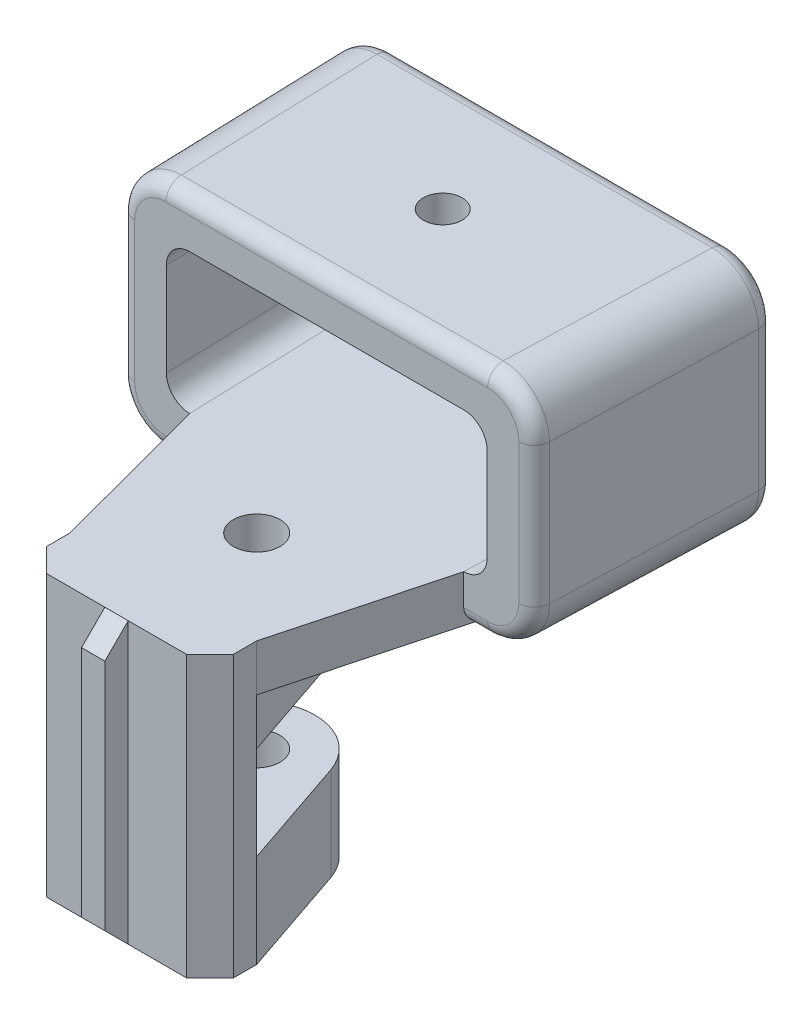
from build123d import *

# Parameters (mm, degrees)
SKETCH_1_R          = 3
EXTRUDE_1_DEPTH     = 12
SKETCH_2_W          = 24
SKETCH_2_H          = 6
EXTRUDE_2_DEPTH     = 36
EXTRUDE_START       = -12
SKETCH_3_R          = 3
EXTRUDE_3_DEPTH     = 12
EXTRUDE_START_2     = -6
SKETCH_5_R          = 3
EXTRUDE_5_DEPTH     = 6
EXTRUDE_7_DEPTH     = 30
EXTRUDE_8_DEPTH     = 3
SKETCH_10_R         = 2.5
EXTRUDE_9_DEPTH     = 6
FILLET_1_R          = 3
FILLET_2_R          = 6
SKETCH_11_W         = 3
SKETCH_11_H         = 12
EXTRUDE_10_DEPTH    = 1.5
SKETCH_12_W         = 73.854631002
SKETCH_12_H         = 4.710162055
CUT_EXTRUDE_1_DEPTH = 13
CUT_EXTRUDE_2_DEPTH = 13
FILLET_3_R          = 2
CHAMFER_1_SIZE      = 3


with BuildPart() as part:
    # 스케치1 → 보스-돌출1 (new body)
    with BuildSketch(Plane(origin=(0, 0, 0), x_dir=(1, 0, 0), z_dir=(0, 1, 0))):
        with BuildLine():
            Line((-12, -12), (12, -12))
            Line((12, -12), (7.101042921, 2.413542921))
            ThreePointArc((7.101042921, 2.413542921), (0, 7.5), (-7.101042921, 2.413542921))
            Line((-7.101042921, 2.413542921), (-12, -12))
        make_face()
        Circle(SKETCH_1_R, mode=Mode.SUBTRACT)
    extrude(amount=EXTRUDE_1_DEPTH)

    # 스케치2 → 보스-돌출2 (add)
    with BuildSketch(Plane(origin=(0, 0, 0), x_dir=(1, 0, 0), z_dir=(0, 1, 0))):
        with Locations((0, -15)):
            Rectangle(SKETCH_2_W, SKETCH_2_H)
    extrude(amount=EXTRUDE_2_DEPTH)

    # 스케치3 → 보스-돌출3 (add)
    with BuildSketch(Plane(origin=(0, 36, 0), x_dir=(1, 0, 0), z_dir=(0, 1, 0)).offset(EXTRUDE_START)):
        with BuildLine():
            Line((-7.101042921, 2.413542921), (-12, -12))
            Line((-12, -12), (12, -12))
            Line((12, -12), (7.101042921, 2.413542921))
            ThreePointArc((7.101042921, 2.413542921), (0, 7.5), (-7.101042921, 2.413542921))
        make_face()
        Circle(SKETCH_3_R, mode=Mode.SUBTRACT)
    extrude(amount=EXTRUDE_3_DEPTH)

    # 스케치5 → 보스-돌출5 (add)
    with BuildSketch(Plane(origin=(0, 36, 0), x_dir=(1, 0, 0), z_dir=(0, 1, 0)).offset(EXTRUDE_START_2)):
        Polygon((20.6, 9), (21.6, 39), (-21.6, 39), (-20.6, 9), (-12, -12), (12, -12), align=None)
        Circle(SKETCH_5_R, mode=Mode.SUBTRACT)
    extrude(amount=EXTRUDE_5_DEPTH)

    # 스케치8 → 보스-돌출7 (add)
    with BuildSketch(Plane.XZ.offset(-30)):
        Polygon((-27.603332408, -39), (-21.6, -39), (-20.6, -9), (-26.603332408, -9), align=None)
        Polygon((20.6, -9), (26.603332408, -9), (27.603332408, -39), (21.6, -39), align=None)
    extrude(amount=-EXTRUDE_7_DEPTH)

    # 스케치9 → 보스-돌출8 (add, symmetric)
    with BuildSketch(Plane(origin=(0, 0, 0), x_dir=(0, 0, -1), z_dir=(1, 0, 0))):
        Polygon((33.7, 30), (6.7, 25), (6.7, 30), align=None)
    extrude(amount=EXTRUDE_8_DEPTH, both=True)

    # 스케치10 → 보스-돌출9 (add)
    with BuildSketch(Plane(origin=(0, 60, 0), x_dir=(1, 0, 0), z_dir=(0, 1, 0))):
        Polygon((20.6, 9), (21.6, 39), (-21.7, 39), (-20.6, 9), align=None)
        with Locations((-0.101268067, 24)):
            Circle(SKETCH_10_R, mode=Mode.SUBTRACT)
    extrude(amount=-EXTRUDE_9_DEPTH)

    # 필렛1
    fillet_1_edges = [part.edges().sort_by_distance(p)[0] for p in [
        (-21.1, 54, -24),
        (-21.1, 36, -24),
        (21.1, 36, -24),
        (21.1, 54, -24),
    ]]
    fillet(fillet_1_edges, radius=FILLET_1_R)

    # 필렛2
    fillet_2_edges = [part.edges().sort_by_distance(p)[0] for p in [
        (-27.103332408, 60, -24),
        (-27.103332408, 30, -24),
        (27.103332408, 30, -24),
        (27.103332408, 60, -24),
    ]]
    fillet(fillet_2_edges, radius=FILLET_2_R)

    # 스케치11 → 보스-돌출10 (add, symmetric)
    with BuildSketch(Plane(origin=(0, 0, 0), x_dir=(0, 0, -1), z_dir=(1, 0, 0))):
        with Locations((-10.5, 18)):
            Rectangle(SKETCH_11_W, SKETCH_11_H)
        Polygon((-18, 36), (-18, 0), (-21, 3), (-21, 33), align=None)
    extrude(amount=EXTRUDE_10_DEPTH, both=True)

    # 스케치12 → 컷-돌출1 (cut)
    with BuildSketch(Plane.XY.offset(-9)):
        with Locations((-1.11650338, 38.355081028)):
            Rectangle(SKETCH_12_W, SKETCH_12_H)
    extrude(amount=CUT_EXTRUDE_1_DEPTH, mode=Mode.SUBTRACT)

    # 스케치13 → 컷-돌출2 (cut)
    with BuildSketch(Plane(origin=(0, 36, 0), x_dir=(1, 0, 0), z_dir=(0, 1, 0))):
        Polygon((-17.598333796, 9), (-12, -12), (-14.220944906, -12), (-22.942076864, 9), align=None)
        Polygon((17.598333796, 9), (12, -12), (13.749532367, -12), (23.601666204, 9), align=None)
    extrude(amount=-CUT_EXTRUDE_2_DEPTH, mode=Mode.SUBTRACT)

    # 필렛3
    fillet_3_edges = [part.edges().sort_by_distance(p)[0] for p in [
        (19.099166898, 30, -9),
        (25.798857897, 32.999687603, -9),
        (26.603332408, 45, -9),
        (24.844407759, 58.243229575, -9),
        (-19.099166898, 30, -9),
        (-25.604752315, 32.686353371, -9),
        (-26.603332408, 45, -9),
        (-24.844407759, 58.243229575, -9),
        (-25.844407759, 58.243229575, -39),
        (-27.603332408, 45, -39),
        (-25.844407759, 31.756770425, -39),
        (0, 30, -39),
        (25.844407759, 31.756770425, -39),
        (27.603332408, 45, -39),
        (25.844407759, 58.243229575, -39),
        (0, 60, -9),
        (0, 60, -39),
    ]]
    fillet(fillet_3_edges, radius=FILLET_3_R)

    # 모따기1
    chamfer_1_edges = [part.edges().sort_by_distance(p)[0] for p in [
        (12, 18, 18),
        (-12, 18, 18),
    ]]
    chamfer(chamfer_1_edges, length=CHAMFER_1_SIZE)


solid = part.part
